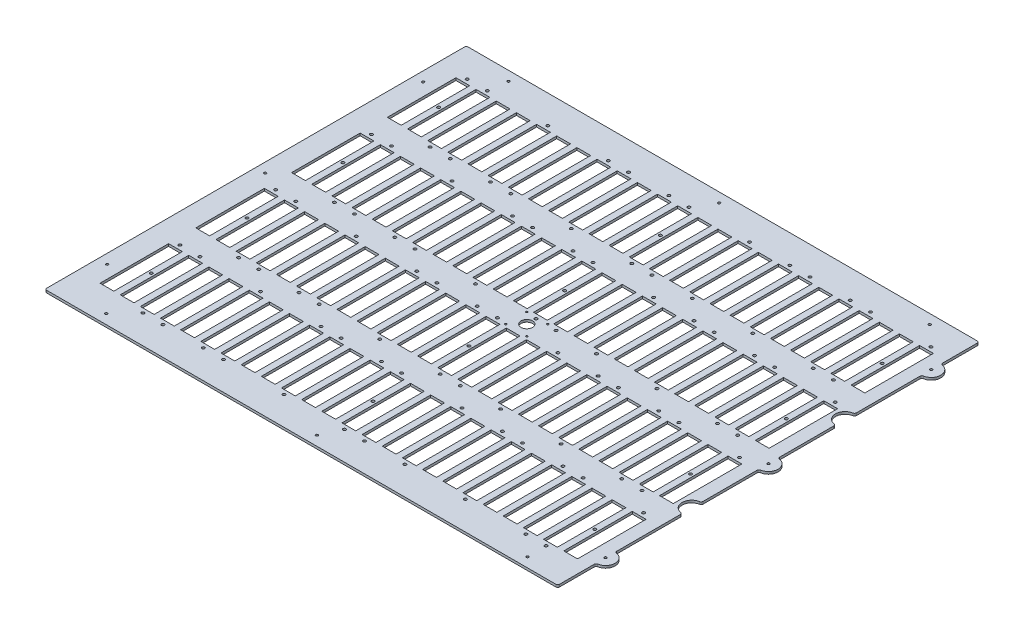
from build123d import *

# Parameters (mm, degrees)
BOSS_EXTRUDE1_DEPTH          = 3.175
SKETCH17_W                   = 18.288
SKETCH17_H                   = 90.932
CUT_EXTRUDE5_DEPTH           = 451.265762746
F_25_0_1495_DIAMETER_HOLE1_D = 3.7973
FILLET1_R                    = 2.54
F_6_CLEARANCE_HOLE1_D        = 3.7973
F_2_CLEARANCE_HOLE1_D        = 2.4384
SKETCH20_R                   = 7.62
CUT_EXTRUDE6_DEPTH           = 451.265762746
F_1_8_0_125_DIAMETER_HOLE1_D = 3.175


with BuildPart() as part:
    # Sketch1 → Boss-Extrude1 (new body)
    with BuildSketch(Plane(origin=(0, 0, 0), x_dir=(1, 0, 0), z_dir=(0, 1, 0))):
        with BuildLine():
            Line((340.1822, 228.7524), (340.1822, 279.5524))
            Line((340.1822, 279.5524), (-340.1822, 279.5524))
            Line((-340.1822, 279.5524), (-340.1822, -279.5524))
            Line((-340.1822, -279.5524), (340.1822, -279.5524))
            Line((340.1822, -279.5524), (340.1822, -228.7524))
            ThreePointArc((340.1822, -228.7524), (352.8822, -216.0524), (340.1822, -203.3524))
            Line((340.1822, -203.3524), (340.1822, -114.4524))
            ThreePointArc((340.1822, -114.4524), (327.4822, -101.7524), (340.1822, -89.0524))
            Line((340.1822, -89.0524), (340.1822, -12.699771398))
            ThreePointArc((340.1822, -12.699771398), (352.9584, 0), (340.1822, 12.699771398))
            Line((340.1822, 12.699771398), (340.1822, 89.0524))
            ThreePointArc((340.1822, 89.0524), (327.4822, 101.7524), (340.1822, 114.4524))
            Line((340.1822, 114.4524), (340.1822, 203.3524))
            ThreePointArc((340.1822, 203.3524), (352.8822, 216.0524), (340.1822, 228.7524))
        make_face()
    extrude(amount=BOSS_EXTRUDE1_DEPTH)

    # Sketch17 → Cut-Extrude5 (cut, through all)
    with BuildSketch(Plane(origin=(0, 3.175, 0), x_dir=(1, 0, 0), z_dir=(0, 1, 0))):
        with Locations((-274.623695652, 190.6524)):
            Rectangle(SKETCH17_W, SKETCH17_H)
        with Locations((-301.371, 190.6524)):
            Rectangle(SKETCH17_W, SKETCH17_H)
        with Locations((-247.876391304, 190.6524)):
            Rectangle(SKETCH17_W, SKETCH17_H)
        with Locations((-221.129086957, 190.6524)):
            Rectangle(SKETCH17_W, SKETCH17_H)
        with Locations((-194.381782609, 190.6524)):
            Rectangle(SKETCH17_W, SKETCH17_H)
        with Locations((-167.634478261, 190.6524)):
            Rectangle(SKETCH17_W, SKETCH17_H)
        with Locations((-140.887173913, 190.6524)):
            Rectangle(SKETCH17_W, SKETCH17_H)
        with Locations((-114.139869565, 190.6524)):
            Rectangle(SKETCH17_W, SKETCH17_H)
        with Locations((-87.392565217, 190.6524)):
            Rectangle(SKETCH17_W, SKETCH17_H)
        with Locations((-60.64526087, 190.6524)):
            Rectangle(SKETCH17_W, SKETCH17_H)
        with Locations((-33.897956522, 190.6524)):
            Rectangle(SKETCH17_W, SKETCH17_H)
        with Locations((-7.150652174, 190.6524)):
            Rectangle(SKETCH17_W, SKETCH17_H)
        with Locations((19.596652174, 190.6524)):
            Rectangle(SKETCH17_W, SKETCH17_H)
        with Locations((46.343956522, 190.6524)):
            Rectangle(SKETCH17_W, SKETCH17_H)
        with Locations((73.09126087, 190.6524)):
            Rectangle(SKETCH17_W, SKETCH17_H)
        with Locations((99.838565217, 190.6524)):
            Rectangle(SKETCH17_W, SKETCH17_H)
        with Locations((126.585869565, 190.6524)):
            Rectangle(SKETCH17_W, SKETCH17_H)
        with Locations((153.333173913, 190.6524)):
            Rectangle(SKETCH17_W, SKETCH17_H)
        with Locations((180.080478261, 190.6524)):
            Rectangle(SKETCH17_W, SKETCH17_H)
        with Locations((206.827782609, 190.6524)):
            Rectangle(SKETCH17_W, SKETCH17_H)
        with Locations((233.575086957, 190.6524)):
            Rectangle(SKETCH17_W, SKETCH17_H)
        with Locations((260.322391304, 190.6524)):
            Rectangle(SKETCH17_W, SKETCH17_H)
        with Locations((287.069695652, 190.6524)):
            Rectangle(SKETCH17_W, SKETCH17_H)
        with Locations((313.817, 190.6524)):
            Rectangle(SKETCH17_W, SKETCH17_H)
        with Locations((-274.623695652, 63.5762)):
            Rectangle(SKETCH17_W, SKETCH17_H)
        with Locations((-247.876391304, 63.5762)):
            Rectangle(SKETCH17_W, SKETCH17_H)
        with Locations((-221.129086957, 63.5762)):
            Rectangle(SKETCH17_W, SKETCH17_H)
        with Locations((-194.381782609, 63.5762)):
            Rectangle(SKETCH17_W, SKETCH17_H)
        with Locations((-167.634478261, 63.5762)):
            Rectangle(SKETCH17_W, SKETCH17_H)
        with Locations((-140.887173913, 63.5762)):
            Rectangle(SKETCH17_W, SKETCH17_H)
        with Locations((-114.139869565, 63.5762)):
            Rectangle(SKETCH17_W, SKETCH17_H)
        with Locations((-87.392565217, 63.5762)):
            Rectangle(SKETCH17_W, SKETCH17_H)
        with Locations((-60.64526087, 63.5762)):
            Rectangle(SKETCH17_W, SKETCH17_H)
        with Locations((-33.897956522, 63.5762)):
            Rectangle(SKETCH17_W, SKETCH17_H)
        with Locations((-7.150652174, 63.5762)):
            Rectangle(SKETCH17_W, SKETCH17_H)
        with Locations((19.596652174, 63.5762)):
            Rectangle(SKETCH17_W, SKETCH17_H)
        with Locations((46.343956522, 63.5762)):
            Rectangle(SKETCH17_W, SKETCH17_H)
        with Locations((73.09126087, 63.5762)):
            Rectangle(SKETCH17_W, SKETCH17_H)
        with Locations((99.838565217, 63.5762)):
            Rectangle(SKETCH17_W, SKETCH17_H)
        with Locations((126.585869565, 63.5762)):
            Rectangle(SKETCH17_W, SKETCH17_H)
        with Locations((153.333173913, 63.5762)):
            Rectangle(SKETCH17_W, SKETCH17_H)
        with Locations((180.080478261, 63.5762)):
            Rectangle(SKETCH17_W, SKETCH17_H)
        with Locations((206.827782609, 63.5762)):
            Rectangle(SKETCH17_W, SKETCH17_H)
        with Locations((233.575086957, 63.5762)):
            Rectangle(SKETCH17_W, SKETCH17_H)
        with Locations((260.322391304, 63.5762)):
            Rectangle(SKETCH17_W, SKETCH17_H)
        with Locations((287.069695652, 63.5762)):
            Rectangle(SKETCH17_W, SKETCH17_H)
        with Locations((313.817, 63.5762)):
            Rectangle(SKETCH17_W, SKETCH17_H)
        with Locations((-274.623695652, -63.5)):
            Rectangle(SKETCH17_W, SKETCH17_H)
        with Locations((-247.876391304, -63.5)):
            Rectangle(SKETCH17_W, SKETCH17_H)
        with Locations((-221.129086957, -63.5)):
            Rectangle(SKETCH17_W, SKETCH17_H)
        with Locations((-194.381782609, -63.5)):
            Rectangle(SKETCH17_W, SKETCH17_H)
        with Locations((-167.634478261, -63.5)):
            Rectangle(SKETCH17_W, SKETCH17_H)
        with Locations((-140.887173913, -63.5)):
            Rectangle(SKETCH17_W, SKETCH17_H)
        with Locations((-114.139869565, -63.5)):
            Rectangle(SKETCH17_W, SKETCH17_H)
        with Locations((-87.392565217, -63.5)):
            Rectangle(SKETCH17_W, SKETCH17_H)
        with Locations((-60.64526087, -63.5)):
            Rectangle(SKETCH17_W, SKETCH17_H)
        with Locations((-33.897956522, -63.5)):
            Rectangle(SKETCH17_W, SKETCH17_H)
        with Locations((-7.150652174, -63.5)):
            Rectangle(SKETCH17_W, SKETCH17_H)
        with Locations((19.596652174, -63.5)):
            Rectangle(SKETCH17_W, SKETCH17_H)
        with Locations((46.343956522, -63.5)):
            Rectangle(SKETCH17_W, SKETCH17_H)
        with Locations((73.09126087, -63.5)):
            Rectangle(SKETCH17_W, SKETCH17_H)
        with Locations((99.838565217, -63.5)):
            Rectangle(SKETCH17_W, SKETCH17_H)
        with Locations((126.585869565, -63.5)):
            Rectangle(SKETCH17_W, SKETCH17_H)
        with Locations((153.333173913, -63.5)):
            Rectangle(SKETCH17_W, SKETCH17_H)
        with Locations((180.080478261, -63.5)):
            Rectangle(SKETCH17_W, SKETCH17_H)
        with Locations((206.827782609, -63.5)):
            Rectangle(SKETCH17_W, SKETCH17_H)
        with Locations((233.575086957, -63.5)):
            Rectangle(SKETCH17_W, SKETCH17_H)
        with Locations((260.322391304, -63.5)):
            Rectangle(SKETCH17_W, SKETCH17_H)
        with Locations((287.069695652, -63.5)):
            Rectangle(SKETCH17_W, SKETCH17_H)
        with Locations((313.817, -63.5)):
            Rectangle(SKETCH17_W, SKETCH17_H)
        with Locations((-274.623695652, -190.5762)):
            Rectangle(SKETCH17_W, SKETCH17_H)
        with Locations((-247.876391304, -190.5762)):
            Rectangle(SKETCH17_W, SKETCH17_H)
        with Locations((-221.129086957, -190.5762)):
            Rectangle(SKETCH17_W, SKETCH17_H)
        with Locations((-194.381782609, -190.5762)):
            Rectangle(SKETCH17_W, SKETCH17_H)
        with Locations((-167.634478261, -190.5762)):
            Rectangle(SKETCH17_W, SKETCH17_H)
        with Locations((-140.887173913, -190.5762)):
            Rectangle(SKETCH17_W, SKETCH17_H)
        with Locations((-114.139869565, -190.5762)):
            Rectangle(SKETCH17_W, SKETCH17_H)
        with Locations((-87.392565217, -190.5762)):
            Rectangle(SKETCH17_W, SKETCH17_H)
        with Locations((-60.64526087, -190.5762)):
            Rectangle(SKETCH17_W, SKETCH17_H)
        with Locations((-33.897956522, -190.5762)):
            Rectangle(SKETCH17_W, SKETCH17_H)
        with Locations((-7.150652174, -190.5762)):
            Rectangle(SKETCH17_W, SKETCH17_H)
        with Locations((19.596652174, -190.5762)):
            Rectangle(SKETCH17_W, SKETCH17_H)
        with Locations((46.343956522, -190.5762)):
            Rectangle(SKETCH17_W, SKETCH17_H)
        with Locations((73.09126087, -190.5762)):
            Rectangle(SKETCH17_W, SKETCH17_H)
        with Locations((99.838565217, -190.5762)):
            Rectangle(SKETCH17_W, SKETCH17_H)
        with Locations((126.585869565, -190.5762)):
            Rectangle(SKETCH17_W, SKETCH17_H)
        with Locations((153.333173913, -190.5762)):
            Rectangle(SKETCH17_W, SKETCH17_H)
        with Locations((180.080478261, -190.5762)):
            Rectangle(SKETCH17_W, SKETCH17_H)
        with Locations((206.827782609, -190.5762)):
            Rectangle(SKETCH17_W, SKETCH17_H)
        with Locations((233.575086957, -190.5762)):
            Rectangle(SKETCH17_W, SKETCH17_H)
        with Locations((260.322391304, -190.5762)):
            Rectangle(SKETCH17_W, SKETCH17_H)
        with Locations((287.069695652, -190.5762)):
            Rectangle(SKETCH17_W, SKETCH17_H)
        with Locations((313.817, -190.5762)):
            Rectangle(SKETCH17_W, SKETCH17_H)
        with Locations((-301.371, 63.5762)):
            Rectangle(SKETCH17_W, SKETCH17_H)
        with Locations((-301.371, -63.5)):
            Rectangle(SKETCH17_W, SKETCH17_H)
        with Locations((-301.371, -190.5762)):
            Rectangle(SKETCH17_W, SKETCH17_H)
    extrude(amount=-CUT_EXTRUDE5_DEPTH, mode=Mode.SUBTRACT)

    # #25 (0.1495) Diameter Hole1 (through all)
    with Locations(Plane(origin=(0, 3.175, 0), x_dir=(1, 0, 0), z_dir=(0, 1, 0))):
        with Locations((313.817, -139.2682), (-301.447239116, 241.9604), (-274.696620024, 241.9604), (-247.946000932, 139.3444), (-221.19538184, 139.3444), (-194.444762748, 241.9604), (-167.694143656, 139.3444), (-140.943524564, 139.3444), (-114.192905472, 241.9604), (-87.44228638, 241.9604), (-60.691667288, 139.3444), (-33.941048196, 241.9604), (-7.190429104, 241.9604), (19.560189988, 139.3444), (46.31080908, 139.3444), (73.061428172, 241.9604), (99.812047264, 139.3444), (126.562666356, 241.9604), (153.313285448, 241.9604), (180.06390454, 139.3444), (206.814523632, 241.9604), (233.565142724, 241.9604), (260.315761816, 139.3444), (287.066380908, 139.3444), (313.817, 241.9604), (-301.447239116, 114.8842), (-274.696620024, 114.8842), (-247.946000932, 12.2682), (-221.19538184, 12.2682), (-194.444762748, 114.8842), (-167.694143656, 12.2682), (-140.943524564, 12.2682), (-114.192905472, 114.8842), (-87.44228638, 114.8842), (-60.691667288, 12.2682), (-33.941048196, 114.8842), (-7.190429104, 114.8842), (19.560189988, 12.2682), (46.31080908, 12.2682), (73.061428172, 114.8842), (99.812047264, 12.2682), (126.562666356, 114.8842), (153.313285448, 114.8842), (180.06390454, 12.2682), (206.814523632, 114.8842), (233.565142724, 114.8842), (260.315761816, 12.2682), (287.066380908, 12.2682), (313.817, 114.8842), (-301.447239116, -12.192), (-274.696620024, -12.192), (-247.946000932, -114.808), (-221.19538184, -114.808), (-194.444762748, -12.192), (-167.694143656, -114.808), (-140.943524564, -114.808), (-114.192905472, -12.192), (-87.44228638, -12.192), (-60.691667288, -114.808), (-33.941048196, -12.192), (-7.190429104, -12.192), (19.560189988, -114.808), (46.31080908, -114.808), (73.061428172, -12.192), (99.812047264, -114.808), (126.562666356, -12.192), (153.313285448, -12.192), (180.06390454, -114.808), (206.814523632, -12.192), (233.565142724, -12.192), (260.315761816, -114.808), (287.066380908, -114.808), (313.817, -12.192), (-301.447239116, -139.2682), (-274.696620024, -139.2682), (-247.946000932, -241.8842), (-221.19538184, -241.8842), (-194.444762748, -139.2682), (-167.694143656, -241.8842), (-140.943524564, -241.8842), (-114.192905472, -139.2682), (-87.44228638, -139.2682), (-60.691667288, -241.8842), (-33.941048196, -139.2682), (-7.190429104, -139.2682), (19.560189988, -241.8842), (46.31080908, -241.8842), (73.061428172, -139.2682), (99.812047264, -241.8842), (126.562666356, -139.2682), (153.313285448, -139.2682), (180.06390454, -241.8842), (206.814523632, -139.2682), (233.565142724, -139.2682), (260.315761816, -241.8842), (287.066380908, -241.8842)):
            Hole(F_25_0_1495_DIAMETER_HOLE1_D / 2)

    # Fillet1
    fillet1_edges = [part.edges().sort_by_distance(p)[0] for p in [
        (-340.1822, 1.5875, -279.5524),
        (-340.1822, 1.5875, 279.5524),
        (340.1822, 1.5875, -279.5524),
        (340.1822, 1.5875, -228.7524),
        (340.1822, 1.5875, 279.5524),
        (340.1822, 1.5875, 228.7524),
        (340.1822, 1.5875, 203.3524),
        (340.1822, 1.5875, 114.4524),
        (340.1822, 1.5875, 89.0524),
        (340.1822, 1.5875, 12.699771398),
        (340.1822, 1.5875, -12.699771398),
        (340.1822, 1.5875, -89.0524),
        (340.1822, 1.5875, -114.4524),
        (340.1822, 1.5875, -203.3524),
    ]]
    fillet(fillet1_edges, radius=FILLET1_R)

    # #6 Clearance Hole1 (through all)
    with Locations(Plane(origin=(0, 3.175, 0), x_dir=(1, 0, 0), z_dir=(0, 1, 0))):
        with Locations((300.443347826, -190.5762), (-287.997347826, 190.6524), (6.223, 190.6524), (300.443347826, 190.6524), (-287.997347826, 63.5762), (6.223, 63.5762), (300.443347826, 63.5762), (-287.997347826, -63.5), (6.223, -63.5), (300.443347826, -63.5), (-287.997347826, -190.5762), (6.223, -190.5762)):
            Hole(F_6_CLEARANCE_HOLE1_D / 2)

    # #2 Clearance Hole1 (through all)
    with Locations(Plane(origin=(0, 3.175, 0), x_dir=(1, 0, 0), z_dir=(0, 1, 0))):
        with Locations((33.5661, 14.0081), (5.6261, 14.0081), (5.6261, -13.9319), (33.5661, -13.9319)):
            Hole(F_2_CLEARANCE_HOLE1_D / 2)

    # Sketch20 → Cut-Extrude6 (cut, through all)
    with BuildSketch(Plane(origin=(0, 3.175, 0), x_dir=(1, 0, 0), z_dir=(0, 1, 0))):
        with Locations((19.5961, 0.0381)):
            Circle(SKETCH20_R)
    extrude(amount=-CUT_EXTRUDE6_DEPTH, mode=Mode.SUBTRACT)

    # 1/8 (0.125) Diameter Hole1 (through all)
    with Locations(Plane(origin=(0, 3.175, 0), x_dir=(1, 0, 0), z_dir=(0, 1, 0))):
        with Locations((287.3502, 266.8524), (287.3502, -266.8524), (7.9502, -266.8524), (-271.4498, -266.8524), (-327.4822, -209.55), (-327.4822, 0), (-327.4822, 209.55), (-271.4498, 266.8524), (7.9502, 266.8524), (340.1822, 216.0524), (340.2584, 0), (340.1822, -216.0524)):
            Hole(F_1_8_0_125_DIAMETER_HOLE1_D / 2)


solid = part.part
